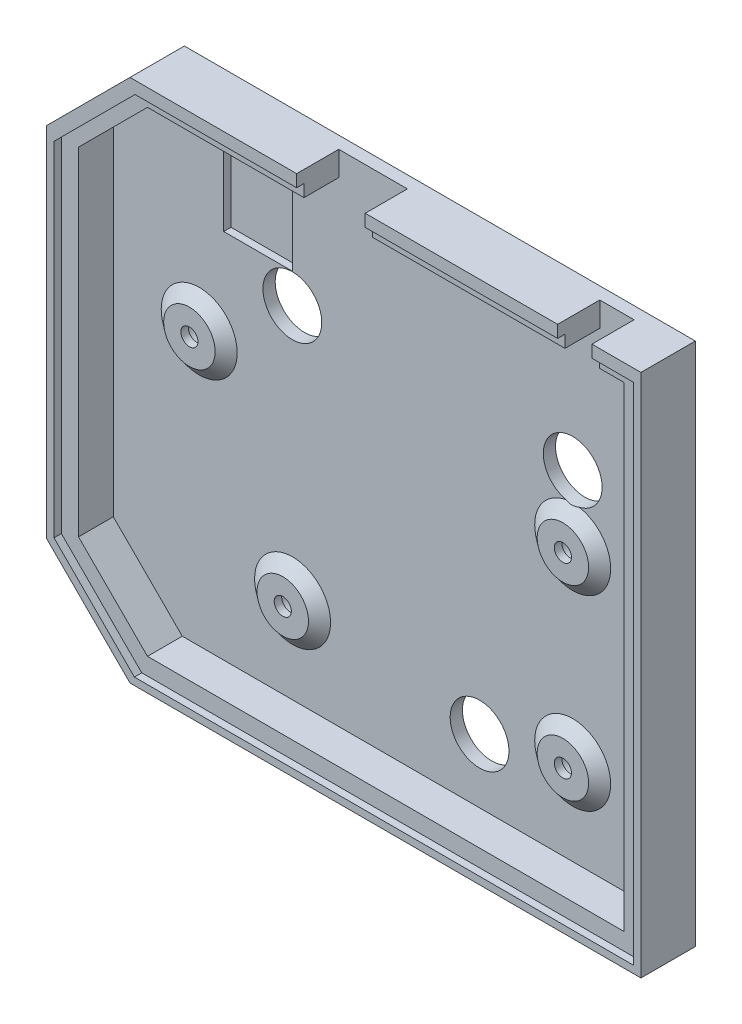
from build123d import *

# Parameters (mm, degrees)
BOSS_EXTRU_1_DEPTH           = 2.5
ESQUISSE2_W                  = 39.25
ESQUISSE2_H                  = 5
BOSS_EXTRU_2_DEPTH           = 8.6
ESQUISSE16_W                 = 1.8
ESQUISSE16_H                 = 2.5
D_GAGEMENT_M32_AT_2_COUNT    = 2
D_GAGEMENT_M32_AT_2_PITCH    = 42.597094971
D_GAGEMENT_M32_AT_3_COUNT    = 2
D_GAGEMENT_M32_AT_3_PITCH    = 76.2
D_GAGEMENT_M32_AT_4_COUNT    = 2
D_GAGEMENT_M32_AT_4_PITCH    = 85.194189943
ESQUISSE18_R                 = 2.7
ENL_V_MAT_EXTRU_2_DEPTH      = 3
ENL_V_MAT_EXTRU_3_DEPTH      = 1.5
ENL_V_MAT_EXTRU_4_DEPTH      = 159.680567493
ENL_V_MAT_EXTRU_4_DEPTH_BACK = 10
ESQUISSE21_R                 = 6
CHANFREIN2_SIZE              = 0.577350269
CHANFREIN2_SIZE_2            = 1
ESQUISSE22_W                 = 14
ESQUISSE22_H                 = 20
ENL_V_MAT_EXTRU_13_DEPTH     = 1.5


with BuildPart() as part:
    # Esquisse1 → Boss.-Extru.1 (new body)
    with BuildSketch(Plane.XY):
        Polygon((0, -85), (17, -102), (121.25, -102), (121.25, 5), (17, 5), (0, -12), align=None)
    extrude(amount=BOSS_EXTRU_1_DEPTH)

    # Esquisse2 → Boss.-Extru.2 (add)
    with BuildSketch(Plane.XY.offset(2.5)):
        Polygon((5, -82.928932188), (19.071067812, -97), (116.25, -97), (116.25, 0), (111.25, 0), (111.25, 5), (121.25, 5), (121.25, -102), (17, -102), (0, -85), (0, -12), (17, 5), (51, 5), (51, 0), (19.071067812, 0), (5, -14.071067812), align=None)
        with Locations((84.625, 2.5)):
            Rectangle(ESQUISSE2_W, ESQUISSE2_H)
    extrude(amount=BOSS_EXTRU_2_DEPTH)

    # Esquisse8 → Révolution3 (revolve)
    with BuildSketch(Plane(origin=(98.725, -41.37, 2.5), x_dir=(0, 0, -1), z_dir=(1, 0, 0)), mode=Mode.PRIVATE) as r_volution3_sk:
        Polygon((0, 1.75), (0, 7.75), (-2, 5.25), (-2, 1.75), align=None)
    revolve(r_volution3_sk.sketch.rotate(Axis((98.725, -41.37, 2.5), (0, 0, 1)), 90), axis=Axis((98.725, -41.37, 2.5), (0, 0, 1)))

    # Esquisse9 → Révolution4 (revolve)
    with BuildSketch(Plane(origin=(41.575, -79.47, 2.5), x_dir=(0, 0, -1), z_dir=(1, 0, 0)), mode=Mode.PRIVATE) as r_volution4_sk:
        Polygon((0, 1.75), (0, 7.75), (-2, 5.25), (-2, 1.75), align=None)
    revolve(r_volution4_sk.sketch.rotate(Axis((41.575, -79.47, 2.5), (0, 0, 1)), 90), axis=Axis((41.575, -79.47, 2.5), (0, 0, 1)))

    # Esquisse10 → Révolution5 (revolve)
    with BuildSketch(Plane(origin=(98.725, -79.47, 2.5), x_dir=(0, 0, -1), z_dir=(1, 0, 0)), mode=Mode.PRIVATE) as r_volution5_sk:
        Polygon((0, 1.75), (0, 7.75), (-2, 5.25), (-2, 1.75), align=None)
    revolve(r_volution5_sk.sketch.rotate(Axis((98.725, -79.47, 2.5), (0, 0, 1)), 90), axis=Axis((98.725, -79.47, 2.5), (0, 0, 1)))

    # Esquisse16 → Dégagement M32 (revolve, cut)
    with BuildSketch(Plane(origin=(22.525, -41.37, 2.5), x_dir=(0, -1, 0), z_dir=(1, 0, 0))):
        with Locations((0.9, 1.25)):
            Rectangle(ESQUISSE16_W, ESQUISSE16_H)
    d_gagement_m32 = revolve(axis=Axis((22.525, -41.37, 8.85), (0, 0, -1)), mode=Mode.SUBTRACT)

    # Dégagement M32 at 2: Dégagement M32 ×2
    with Locations(*[Vector(0.4472135954999577, -0.8944271909999161, 0) * (i * D_GAGEMENT_M32_AT_2_PITCH) for i in range(1, D_GAGEMENT_M32_AT_2_COUNT)]):
        add(d_gagement_m32, mode=Mode.SUBTRACT)

    # Dégagement M32 at 3: Dégagement M32 ×2
    with Locations(*[(i * D_GAGEMENT_M32_AT_3_PITCH, 0, 0) for i in range(1, D_GAGEMENT_M32_AT_3_COUNT)]):
        add(d_gagement_m32, mode=Mode.SUBTRACT)

    # Dégagement M32 at 4: Dégagement M32 ×2
    with Locations(*[Vector(0.8944271909999159, -0.44721359549995804, 0) * (i * D_GAGEMENT_M32_AT_4_PITCH) for i in range(1, D_GAGEMENT_M32_AT_4_COUNT)]):
        add(d_gagement_m32, mode=Mode.SUBTRACT)

    # Esquisse17 → Révolution6 (revolve)
    with BuildSketch(Plane(origin=(22.525, -41.37, 2.5), x_dir=(0, 0, -1), z_dir=(1, 0, 0)), mode=Mode.PRIVATE) as r_volution6_sk:
        Polygon((0, 1.75), (0, 7.75), (-2, 5.25), (-2, 1.75), align=None)
    revolve(r_volution6_sk.sketch.rotate(Axis((22.525, -41.37, 2.5), (0, 0, 1)), 90), axis=Axis((22.525, -41.37, 2.5), (0, 0, 1)))

    # Esquisse18 → Enlèv. mat.-Extru.2 (cut)
    with BuildSketch(Plane(origin=(0, 0, 0), x_dir=(-1, 0, 0), z_dir=(0, 0, -1))):
        with Locations((-22.525, -41.37)):
            Circle(ESQUISSE18_R)
        with Locations((-98.725, -41.37)):
            Circle(ESQUISSE18_R)
        with Locations((-41.575, -79.47)):
            Circle(ESQUISSE18_R)
        with Locations((-98.725, -79.47)):
            Circle(ESQUISSE18_R)
    extrude(amount=-ENL_V_MAT_EXTRU_2_DEPTH, mode=Mode.SUBTRACT)

    # Esquisse20 → Enlèv. mat.-Extru.3 (cut)
    with BuildSketch(Plane.XY.offset(11.1)):
        Polygon((119.75, 2.5), (18.035533906, 2.5), (1.5, -14.035533906), (1.5, -84.095836944), (17.904163056, -100.5), (119.75, -100.5), align=None)
    extrude(amount=-ENL_V_MAT_EXTRU_3_DEPTH, mode=Mode.SUBTRACT)

    # Esquisse21 → Enlèv. mat.-Extru.4 (cut, two sides: drawn at the far end of the back side and taken through both)
    with BuildSketch(Plane.XY.offset(2.5).offset(-ENL_V_MAT_EXTRU_4_DEPTH_BACK)):
        with Locations(Location((98.725, -27.87, 0), (0, 0, 180))):
            Circle(ESQUISSE21_R)
        with Locations(Location((41.525, -27.37, 0), (0, 0, 180))):
            Circle(ESQUISSE21_R)
        with Locations(Location((79.725, -83.97, 0), (0, 0, 180))):
            Circle(ESQUISSE21_R)
    extrude(amount=ENL_V_MAT_EXTRU_4_DEPTH + ENL_V_MAT_EXTRU_4_DEPTH_BACK, mode=Mode.SUBTRACT)

    # Chanfrein2
    # the kernel refuses this chamfer: 1, 0.577350269 mm, written as the material it adds along each edge
    with BuildSketch(Plane(origin=(98.725, -79.47, 3), x_dir=(-1, 0, 0), z_dir=(0, -1, 0))) as chanfrein2_piece_1_section:
        Polygon((2.7, CHANFREIN2_SIZE), (2.7 - CHANFREIN2_SIZE_2, 0), (2.7, 0), align=None)
    chanfrein2_piece_1 = revolve(axis=Axis((98.725, -79.47, 3), (0, 0, -1)), mode=Mode.PRIVATE)
    chanfrein2_piece_1 = chanfrein2_piece_1 - Plane(origin=(98.725, -79.47, 2.701530762), x_dir=(-1, 0, 0), z_dir=(0, 0, -1)) * Cylinder(1.75, 11, mode=Mode.PRIVATE)
    add(chanfrein2_piece_1)
    with BuildSketch(Plane(origin=(41.575, -79.47, 3), x_dir=(-1, 0, 0), z_dir=(0, -1, 0))) as chanfrein2_piece_2_section:
        Polygon((2.7, CHANFREIN2_SIZE), (2.7 - CHANFREIN2_SIZE_2, 0), (2.7, 0), align=None)
    chanfrein2_piece_2 = revolve(axis=Axis((41.575, -79.47, 3), (0, 0, -1)), mode=Mode.PRIVATE)
    chanfrein2_piece_2 = chanfrein2_piece_2 - Plane(origin=(41.575, -79.47, 2.701530762), x_dir=(-1, 0, 0), z_dir=(0, 0, -1)) * Cylinder(1.75, 11, mode=Mode.PRIVATE)
    add(chanfrein2_piece_2)
    with BuildSketch(Plane(origin=(22.525, -41.37, 3), x_dir=(-1, 0, 0), z_dir=(0, -1, 0))) as chanfrein2_piece_3_section:
        Polygon((2.7, CHANFREIN2_SIZE), (2.7 - CHANFREIN2_SIZE_2, 0), (2.7, 0), align=None)
    chanfrein2_piece_3 = revolve(axis=Axis((22.525, -41.37, 3), (0, 0, -1)), mode=Mode.PRIVATE)
    chanfrein2_piece_3 = chanfrein2_piece_3 - Plane(origin=(22.525, -41.37, 2.701530762), x_dir=(-1, 0, 0), z_dir=(0, 0, -1)) * Cylinder(1.75, 11, mode=Mode.PRIVATE)
    add(chanfrein2_piece_3)
    with BuildSketch(Plane(origin=(98.725, -41.37, 3), x_dir=(-1, 0, 0), z_dir=(0, -1, 0))) as chanfrein2_piece_4_section:
        Polygon((2.7, CHANFREIN2_SIZE), (2.7 - CHANFREIN2_SIZE_2, 0), (2.7, 0), align=None)
    chanfrein2_piece_4 = revolve(axis=Axis((98.725, -41.37, 3), (0, 0, -1)), mode=Mode.PRIVATE)
    chanfrein2_piece_4 = chanfrein2_piece_4 - Plane(origin=(98.725, -41.37, 2.701530762), x_dir=(-1, 0, 0), z_dir=(0, 0, -1)) * Cylinder(1.75, 11, mode=Mode.PRIVATE)
    add(chanfrein2_piece_4)

    # Esquisse22 → Enlèv. mat.-Extru.13 (cut)
    with BuildSketch(Plane.XY.offset(2.5)):
        with Locations((34.525, -11.27)):
            Rectangle(ESQUISSE22_W, ESQUISSE22_H)
    extrude(amount=-ENL_V_MAT_EXTRU_13_DEPTH, mode=Mode.SUBTRACT)


solid = part.part
